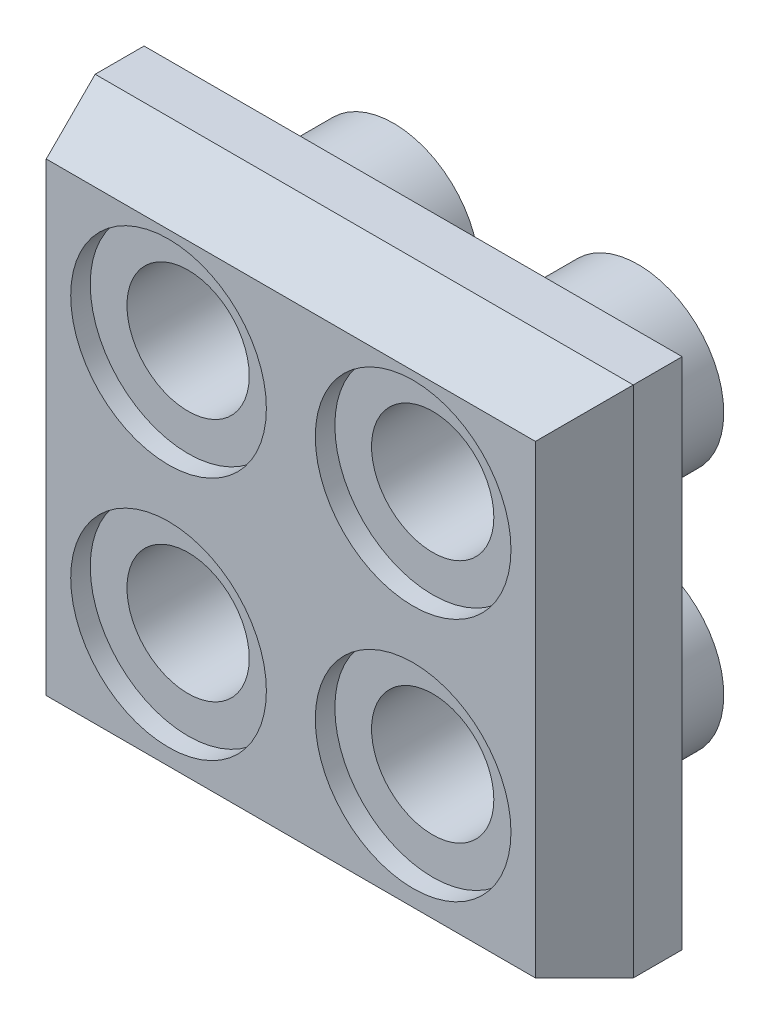
from build123d import *

# Parameters (mm, degrees)
LOFT6_OUTLINE_W     = 20
LOFT6_OUTLINE_H     = 19
LOFT6_DEPTH         = 3
LOFT6_DRAFT         = 18.4349488
SKETCH4_W           = 22
SKETCH4_H           = 21
BOSS_EXTRUDE1_DEPTH = 2
SHELL1_T            = -1
SKETCH5_R           = 3.5
SKETCH5_R_2         = 2.5
BOSS_EXTRUDE2_DEPTH = 9.2
SKETCH5_2_R         = 2.5
CUT_EXTRUDE1_DEPTH  = 9.2
SKETCH6_R           = 4
SKETCH6_R_2         = 2.5
CUT_EXTRUDE3_DEPTH  = 0.8


# Read off the part's stored shape, not the designer's step: Loft6
with BuildPart() as part:
    # Loft6 outline → Loft6 (with draft: the straight prism first)
    with BuildSketch(Plane.XY.offset(3)):
        with Locations((0, -4.5)):
            Rectangle(LOFT6_OUTLINE_W, LOFT6_OUTLINE_H)
    extrude(amount=-LOFT6_DEPTH)
    # Loft6: the draft: its side faces are tilted about the plane it starts from
    loft6_sides = [part.faces().sort_by_distance(p)[0] for p in [
        (10, -4.5, 1.5),
        (0, 5, 1.5),
        (-10, -4.5, 1.5),
        (0, -14, 1.5),
    ]]
    draft(loft6_sides, Plane.XY.offset(3), LOFT6_DRAFT)

    # Sketch4 → Boss-Extrude1 (add)
    with BuildSketch(Plane(origin=(0, 0, 0), x_dir=(-1, 0, 0), z_dir=(0, 0, -1))):
        with Locations((0, -4.5)):
            Rectangle(SKETCH4_W, SKETCH4_H)
    extrude(amount=BOSS_EXTRUDE1_DEPTH)

    # Shell1
    shell1_openings = [part.faces().sort_by_distance(p)[0] for p in [
        (0, -4.5, -2),
    ]]
    offset(amount=SHELL1_T, openings=shell1_openings, kind=Kind.INTERSECTION)

    # Sketch5 → Boss-Extrude2 (add)
    # profile 1 of 4: a face of its own
    with BuildSketch(Plane.XY.offset(3)):
        with Locations((-5, 0.666820713)):
            Circle(SKETCH5_R)
        with Locations((-5, 0.666820713)):
            Circle(SKETCH5_R_2, mode=Mode.SUBTRACT)
    # profile 2 of 4: a face of its own
    with BuildSketch(Plane.XY.offset(3)):
        with Locations((5, 0.666820713)):
            Circle(SKETCH5_R)
        with Locations((5, 0.666820713)):
            Circle(SKETCH5_R_2, mode=Mode.SUBTRACT)
    # profile 3 of 4: a face of its own
    with BuildSketch(Plane.XY.offset(3)):
        with Locations((-5, -9.333179287)):
            Circle(SKETCH5_R)
        with Locations((-5, -9.333179287)):
            Circle(SKETCH5_R_2, mode=Mode.SUBTRACT)
    # profile 4 of 4: a face of its own
    with BuildSketch(Plane.XY.offset(3)):
        with Locations((5, -9.333179287)):
            Circle(SKETCH5_R)
        with Locations((5, -9.333179287)):
            Circle(SKETCH5_R_2, mode=Mode.SUBTRACT)
    extrude(amount=-BOSS_EXTRUDE2_DEPTH)

    # Sketch5<2> → Cut-Extrude1 (cut)
    with BuildSketch(Plane.XY.offset(3)):
        with Locations((-5, 0.666820713)):
            Circle(SKETCH5_2_R)
        with Locations((5, 0.666820713)):
            Circle(SKETCH5_2_R)
        with Locations((5, -9.333179287)):
            Circle(SKETCH5_2_R)
        with Locations((-5, -9.333179287)):
            Circle(SKETCH5_2_R)
    extrude(amount=-CUT_EXTRUDE1_DEPTH, mode=Mode.SUBTRACT)

    # Sketch6 → Cut-Extrude3 (cut)
    # profile 1 of 4: a face of its own
    with BuildSketch(Plane.XY.offset(3)):
        with Locations((-5, 0.666820713)):
            Circle(SKETCH6_R)
        with Locations((-5, 0.666820713)):
            Circle(SKETCH6_R_2, mode=Mode.SUBTRACT)
    # profile 2 of 4: a face of its own
    with BuildSketch(Plane.XY.offset(3)):
        with Locations((5, 0.666820713)):
            Circle(SKETCH6_R)
        with Locations((5, 0.666820713)):
            Circle(SKETCH6_R_2, mode=Mode.SUBTRACT)
    # profile 3 of 4: a face of its own
    with BuildSketch(Plane.XY.offset(3)):
        with Locations((5, -9.333179287)):
            Circle(SKETCH6_R)
        with Locations((5, -9.333179287)):
            Circle(SKETCH6_R_2, mode=Mode.SUBTRACT)
    # profile 4 of 4: a face of its own
    with BuildSketch(Plane.XY.offset(3)):
        with Locations((-5, -9.333179287)):
            Circle(SKETCH6_R)
        with Locations((-5, -9.333179287)):
            Circle(SKETCH6_R_2, mode=Mode.SUBTRACT)
    extrude(amount=-CUT_EXTRUDE3_DEPTH, mode=Mode.SUBTRACT)


solid = part.part
